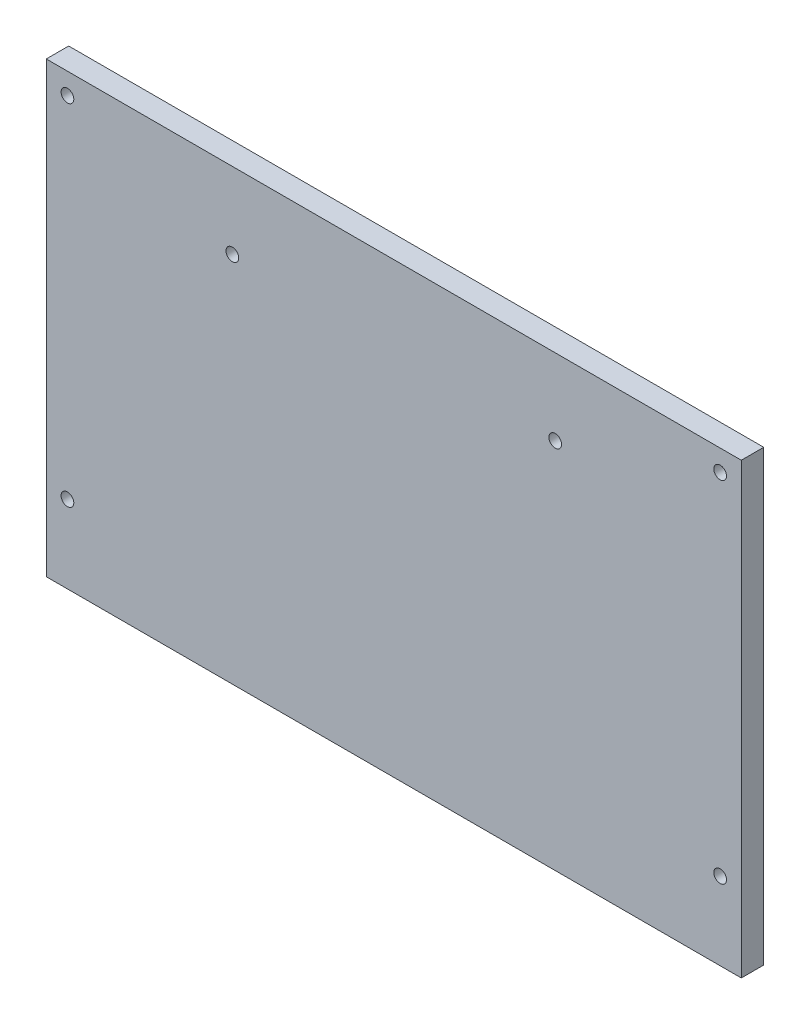
from build123d import *

# Parameters (mm, degrees)
SKETCH1_W            = 196.85
SKETCH1_H            = 127
BOSS_EXTRUDE1_DEPTH  = 6.35
M3_CLEARANCE_HOLE1_D = 3.6
M3_CLEARANCE_HOLE2_D = 3.6


with BuildPart() as part:
    # Sketch1 → Boss-Extrude1 (new body)
    with BuildSketch(Plane.XY):
        with Locations((98.425, 63.5)):
            Rectangle(SKETCH1_W, SKETCH1_H)
    extrude(amount=BOSS_EXTRUDE1_DEPTH)

    # M3 Clearance Hole1 (through all)
    with Locations(Plane.XY.offset(6.35)):
        with Locations((5.9944, 121.0056), (5.9944, 21.9964), (190.8556, 21.9964), (190.8556, 121.0056)):
            Hole(M3_CLEARANCE_HOLE1_D / 2)

    # M3 Clearance Hole2 (through all)
    with Locations(Plane.XY.offset(6.35)):
        with Locations((52.705, 105.41), (144.145, 105.41)):
            Hole(M3_CLEARANCE_HOLE2_D / 2)


solid = part.part
